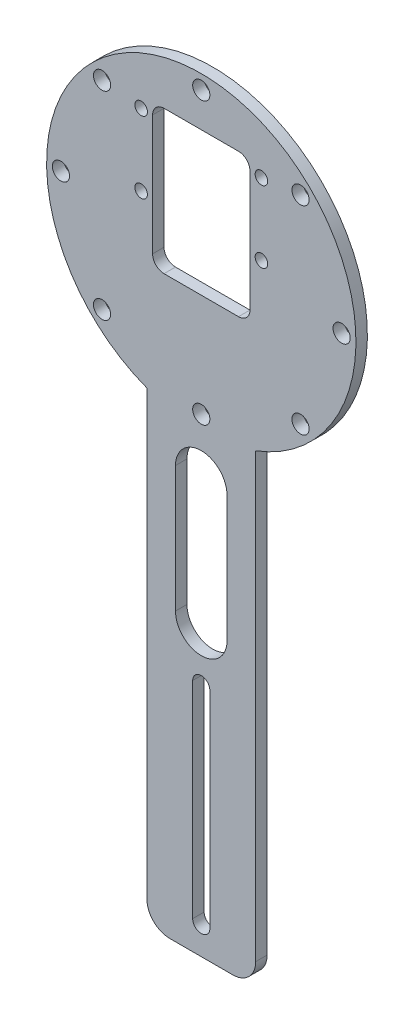
from build123d import *

# Parameters (mm, degrees)
ESQUISSE1_R             = 1.1
ESQUISSE1_R_2           = 1.5
ESQUISSE1_W             = 17
ESQUISSE1_H             = 25
BOSS_EXTRU_1_DEPTH      = 2
CONG_1_R                = 2
ENL_V_MAT_EXTRU_1_DEPTH = 2
CONG_2_R                = 4


with BuildPart() as part:
    # Esquisse1 → Boss.-Extru.1 (new body)
    with BuildSketch(Plane.XY):
        with BuildLine():
            Line((9.5, 0), (-9.5, 0))
            Line((-9.5, 0), (-9.5, 81.226496088))
            ThreePointArc((-9.5, 81.226496088), (0, 133.5), (9.5, 81.226496088))
            Line((9.5, 81.226496088), (9.5, 0))
        make_face()
        with Locations((-10.5, 123)):
            Circle(ESQUISSE1_R, mode=Mode.SUBTRACT)
        with Locations((-10.5, 110.5)):
            Circle(ESQUISSE1_R, mode=Mode.SUBTRACT)
        with Locations((10.5, 110.5)):
            Circle(ESQUISSE1_R, mode=Mode.SUBTRACT)
        with Locations((10.5, 123)):
            Circle(ESQUISSE1_R, mode=Mode.SUBTRACT)
        with Locations((0, 131)):
            Circle(ESQUISSE1_R_2, mode=Mode.SUBTRACT)
        with Locations((17.324116139, 123.824116139)):
            Circle(ESQUISSE1_R_2, mode=Mode.SUBTRACT)
        with Locations((24.5, 106.5)):
            Circle(ESQUISSE1_R_2, mode=Mode.SUBTRACT)
        with Locations((17.324116139, 89.175883861)):
            Circle(ESQUISSE1_R_2, mode=Mode.SUBTRACT)
        with Locations((0, 82)):
            Circle(ESQUISSE1_R_2, mode=Mode.SUBTRACT)
        with Locations((-17.324116139, 89.175883861)):
            Circle(ESQUISSE1_R_2, mode=Mode.SUBTRACT)
        with Locations((-24.5, 106.5)):
            Circle(ESQUISSE1_R_2, mode=Mode.SUBTRACT)
        with Locations((-17.324116139, 123.824116139)):
            Circle(ESQUISSE1_R_2, mode=Mode.SUBTRACT)
        with Locations((0, 112.5)):
            Rectangle(ESQUISSE1_W, ESQUISSE1_H, mode=Mode.SUBTRACT)
    extrude(amount=BOSS_EXTRU_1_DEPTH)

    # Congé1
    cong_1_edges = [part.edges().sort_by_distance(p)[0] for p in [
        (-8.5, 100, 1),
        (8.5, 100, 1),
        (8.5, 125, 1),
        (-8.5, 125, 1),
    ]]
    fillet(cong_1_edges, radius=CONG_1_R)

    # Esquisse2 → Enlèv. mat.-Extru.1 (cut)
    with BuildSketch(Plane.XY.offset(2)):
        with BuildLine():
            Line((4.5, 72), (4.5, 50))
            ThreePointArc((4.5, 50), (0, 45.5), (-4.5, 50))
            Line((-4.5, 50), (-4.5, 72))
            ThreePointArc((-4.5, 72), (0, 76.5), (4.5, 72))
        make_face()
        with BuildLine():
            Line((1.5, 41), (1.5, 5))
            ThreePointArc((1.5, 5), (0, 3.5), (-1.5, 5))
            Line((-1.5, 5), (-1.5, 41))
            ThreePointArc((-1.5, 41), (0, 42.5), (1.5, 41))
        make_face()
    extrude(amount=-ENL_V_MAT_EXTRU_1_DEPTH, mode=Mode.SUBTRACT)

    # Congé2
    cong_2_edges = [part.edges().sort_by_distance(p)[0] for p in [
        (-9.5, 0, 1),
        (9.5, 0, 1),
    ]]
    fillet(cong_2_edges, radius=CONG_2_R)


solid = part.part
